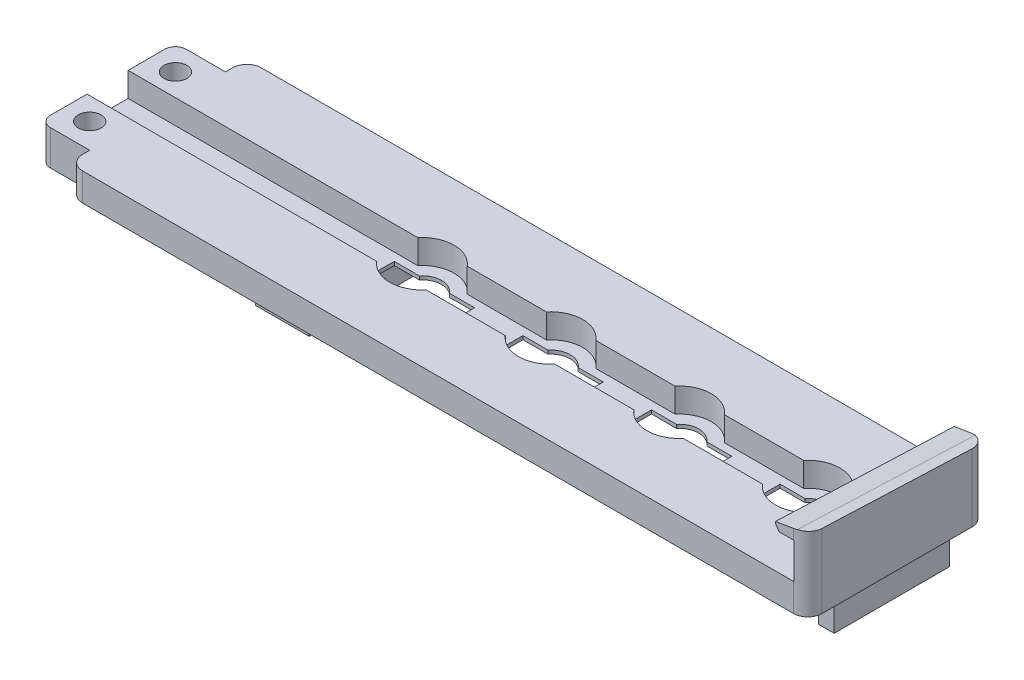
from build123d import *
from OCP.BRepFilletAPI import BRepFilletAPI_MakeChamfer

# Parameters (mm, degrees)
SKETCH1_W                = 99.5
SKETCH1_H                = 25
BOSS_EXTRUDE1_DEPTH      = 3.9
SKETCH2_R                = 2.75
CUT_EXTRUDE1_DEPTH       = 52.444363151
SKETCH4_W                = 2
SKETCH4_H                = 25
BOSS_EXTRUDE2_DEPTH      = 3.9
SNAP_START               = -51.12804878
SNAP_HOOK1_DEPTH         = 1.37804878
SNAP_START_2             = -10.052407779
SNAP_HOOK1_2_DEPTH       = 20.104815558
SNAP_START_3             = -10.267279674
SNAP_HOOK1_3_DEPTH       = 20.534559348
SNAP_START_4             = -53
SNAP_HOOK1_4_DEPTH       = 5
CUT_EXTRUDE2_DEPTH       = 3.4
SKETCH6_W                = 131.446270808
SKETCH6_H                = 5.75
CUT_EXTRUDE3_DEPTH       = 3.4
FILLET3_R                = 2
SKETCH12_W               = 3.5
SKETCH12_H               = 3.5
CUT_EXTRUDE8_DEPTH       = 3.9
SKETCH13_W               = 19.63116991
SKETCH13_H               = 5.75
CUT_EXTRUDE9_DEPTH       = 10
BOSS_EXTRUDE8_DEPTH      = 1
BOSS_EXTRUDE8_DEPTH_BACK = 3.9
SKETCH15_W               = 7
SKETCH15_H               = 19
SKETCH15_R               = 1.6
CUT_EXTRUDE10_DEPTH      = 2
SKETCH17_W               = 7.226910769
SKETCH17_H               = 5.75
CUT_EXTRUDE11_DEPTH      = 3.4
FILLET6_R                = 1.5
SKETCH18_W               = 7.5
SKETCH18_H               = 18
BOSS_EXTRUDE9_DEPTH      = 3.8
SKETCH21_W               = 7.5
SKETCH21_H               = 16.5
SKETCH21_W_2             = 2.196133812
SKETCH21_H_2             = 16.144777587
BOSS_EXTRUDE11_DEPTH     = 3.8
FILLET7_R                = 1
SKETCH22_W               = 5.52852217
SKETCH22_H               = 24.476704992
SKETCH22_W_2             = 17.032273736
SKETCH22_H_2             = 39.798184175
CUT_EXTRUDE14_DEPTH      = 5.1
BOSS_EXTRUDE12_START     = 9.9
BOSS_EXTRUDE12_DEPTH     = 9.9
CUT_EXTRUDE15_DEPTH      = 2.6
CUT_EXTRUDE16_DEPTH      = 105.769556647
CHAMFER1_SIZE            = 3
CHAMFER1_SIZE2           = 0.475153321
CHAMFER2_SIZE            = 0.5
CHAMFER2_SIZE2           = 0.714074003
SKETCH28_W               = 5.417071425
SKETCH28_H               = 25.110658167
CUT_EXTRUDE18_DEPTH      = 61.55660575
SPLIT1_SURFACE_1_BACK    = 115.179
SPLIT1_SURFACE_1_DEPTH   = 230.358
SPLIT1_SURFACE_2_BACK    = 115.179
SPLIT1_SURFACE_2_DEPTH   = 230.358


with BuildPart() as part:
    # Sketch1 → Boss-Extrude1 (new body)
    with BuildSketch(Plane(origin=(0, 0, 0), x_dir=(1, 0, 0), z_dir=(0, 1, 0))):
        Rectangle(SKETCH1_W, SKETCH1_H)
    extrude(amount=BOSS_EXTRUDE1_DEPTH)

    # Sketch2 → Cut-Extrude1 (cut, through all)
    with BuildSketch(Plane(origin=(0, 3.9, 0), x_dir=(1, 0, 0), z_dir=(0, 1, 0))):
        with Locations(Location((-14.75, 0, 0), (0, 0, 270))):
            Circle(SKETCH2_R)
        with Locations(Location((3.25, 0, 0), (0, 0, 270))):
            Circle(SKETCH2_R)
        with Locations(Location((21.25, 0, 0), (0, 0, 270))):
            Circle(SKETCH2_R)
        with Locations(Location((39.25, 0, 0), (0, 0, 270))):
            Circle(SKETCH2_R)
    extrude(amount=-CUT_EXTRUDE1_DEPTH, mode=Mode.SUBTRACT)

    # Sketch4 → Boss-Extrude2 (add)
    with BuildSketch(Plane(origin=(0, 0, 0), x_dir=(1, 0, 0), z_dir=(0, 1, 0))):
        with Locations((-50.75, 0)):
            Rectangle(SKETCH4_W, SKETCH4_H)
        with Locations((50.75, 0)):
            Rectangle(SKETCH4_W, SKETCH4_H)
    extrude(amount=BOSS_EXTRUDE2_DEPTH)

    # Snap Hook1: read off the stored shape, not the designer's step
    # Snap Hook1 outline → Snap Hook1 (add)
    with BuildSketch(Plane.YZ.offset(SNAP_START)):
        Polygon((9, -10), (9, 10), (3.9, 10.267279674), (3.9, -10.267279674), align=None)
    snap_hook1 = extrude(amount=SNAP_HOOK1_DEPTH)

    # Snap Hook1 2 outline → Snap Hook1 2 (add)
    with BuildSketch(Plane.XY.offset(SNAP_START_2)):
        Polygon((-51.12804878, 3.9), (-51.12804878, 9), (-51.75, 3.9), align=None)
        Polygon((-49.75, 9), (-49.75, 8), (-48.75, 8), (-48.75, 8.5), align=None)
    snap_hook1_2 = extrude(amount=SNAP_HOOK1_2_DEPTH)

    # Snap Hook1 3 outline → Snap Hook1 3 (add)
    with BuildSketch(Plane.XY.offset(SNAP_START_3)):
        Polygon((-51.12804878, 3.9), (-51.12804878, 9), (-51.75, 3.9), align=None)
    snap_hook1_3 = extrude(amount=SNAP_HOOK1_3_DEPTH)

    # Snap Hook1 4 outline → Snap Hook1 4 (cut)
    with BuildSketch(Plane.YZ.offset(SNAP_START_4)):
        Polygon((9, 10), (10, 9.947592221), (10, 10.267279674), (3.9, 10.267279674), align=None)
        Polygon((10, -9.947592221), (9, -10), (3.9, -10.267279674), (10, -10.267279674), align=None)
    snap_hook1_4 = extrude(amount=SNAP_HOOK1_4_DEPTH, mode=Mode.SUBTRACT)

    # Mirror1: Snap Hook1, Snap Hook1 2, Snap Hook1 3, Snap Hook1 4 across plane
    add(snap_hook1.mirror(Plane(origin=(0, 0, 0), x_dir=(0, 0, 1), z_dir=(1, 0, 0))))
    add(snap_hook1_2.mirror(Plane(origin=(0, 0, 0), x_dir=(0, 0, 1), z_dir=(1, 0, 0))))
    add(snap_hook1_3.mirror(Plane(origin=(0, 0, 0), x_dir=(0, 0, 1), z_dir=(1, 0, 0))))
    add(snap_hook1_4.mirror(Plane(origin=(0, 0, 0), x_dir=(0, 0, 1), z_dir=(1, 0, 0))), mode=Mode.SUBTRACT)

    # Sketch5 → Cut-Extrude2 (cut)
    with BuildSketch(Plane(origin=(0, 3.9, 0), x_dir=(1, 0, 0), z_dir=(0, 1, 0))):
        with BuildLine():
            Line((-18.75, 2.061552813), (-18.75, -2.061552813))
            ThreePointArc((-18.75, -2.061552813), (-14.75, -4.5), (-10.75, -2.061552813))
            Line((-10.75, -2.061552813), (-10.75, 2.061552813))
            ThreePointArc((-10.75, 2.061552813), (-14.75, 4.5), (-18.75, 2.061552813))
        make_face()
        with BuildLine():
            Line((-0.75, 2.061552813), (-0.75, -2.061552813))
            ThreePointArc((-0.75, -2.061552813), (3.25, -4.5), (7.25, -2.061552813))
            Line((7.25, -2.061552813), (7.25, 2.061552813))
            ThreePointArc((7.25, 2.061552813), (3.25, 4.5), (-0.75, 2.061552813))
        make_face()
        with BuildLine():
            Line((17.25, 2.061552813), (17.25, -2.061552813))
            ThreePointArc((17.25, -2.061552813), (21.25, -4.5), (25.25, -2.061552813))
            Line((25.25, -2.061552813), (25.25, 2.061552813))
            ThreePointArc((25.25, 2.061552813), (21.25, 4.5), (17.25, 2.061552813))
        make_face()
        with BuildLine():
            Line((35.25, 2.061552813), (35.25, -2.061552813))
            ThreePointArc((35.25, -2.061552813), (39.25, -4.5), (43.25, -2.061552813))
            Line((43.25, -2.061552813), (43.25, 2.061552813))
            ThreePointArc((43.25, 2.061552813), (39.25, 4.5), (35.25, 2.061552813))
        make_face()
    extrude(amount=-CUT_EXTRUDE2_DEPTH, mode=Mode.SUBTRACT)

    # Sketch6 → Cut-Extrude3 (cut)
    with BuildSketch(Plane(origin=(0, 3.9, 0), x_dir=(1, 0, 0), z_dir=(0, 1, 0))):
        with Locations((3.25, 0)):
            Rectangle(SKETCH6_W, SKETCH6_H)
    extrude(amount=-CUT_EXTRUDE3_DEPTH, mode=Mode.SUBTRACT)

    # Fillet3
    fillet3_edges = [part.edges().sort_by_distance(p)[0] for p in [
        (-51.75, 1.95, -12.5),
        (-51.75, 1.95, 12.5),
        (51.75, 1.95, 12.5),
        (51.75, 1.95, -12.5),
    ]]
    fillet(fillet3_edges, radius=FILLET3_R)

    # Sketch12 → Cut-Extrude8 (cut)
    with BuildSketch(Plane(origin=(0, 0, 0), x_dir=(1, 0, 0), z_dir=(0, 1, 0))):
        with Locations((-10.878679656, 0)):
            Rectangle(SKETCH12_W, SKETCH12_H)
        with Locations((-18.621320344, 0)):
            Rectangle(SKETCH12_W, SKETCH12_H)
        with Locations((7.121320344, 0)):
            Rectangle(SKETCH12_W, SKETCH12_H)
        with Locations((-0.621320344, 0)):
            Rectangle(SKETCH12_W, SKETCH12_H)
        with Locations((25.121320344, 0)):
            Rectangle(SKETCH12_W, SKETCH12_H)
        with Locations((17.378679656, 0)):
            Rectangle(SKETCH12_W, SKETCH12_H)
        with Locations((43.121320344, 0)):
            Rectangle(SKETCH12_W, SKETCH12_H)
        with Locations((35.378679656, 0)):
            Rectangle(SKETCH12_W, SKETCH12_H)
    extrude(amount=CUT_EXTRUDE8_DEPTH, mode=Mode.SUBTRACT)

    # Sketch13 → Cut-Extrude9 (cut)
    with BuildSketch(Plane(origin=(0, 0.5, 0), x_dir=(1, 0, 0), z_dir=(0, 1, 0))):
        with Locations((-45.74538215, -0.005)):
            Rectangle(SKETCH13_W, SKETCH13_H)
    extrude(amount=CUT_EXTRUDE9_DEPTH, mode=Mode.SUBTRACT)

    # Sketch18 → Boss-Extrude9 (add)
    with BuildSketch(Plane(origin=(0, 0, 0), x_dir=(-1, 0, 0), z_dir=(0, -1, 0))):
        with Locations((25.281035949, 0)):
            Rectangle(SKETCH18_W, SKETCH18_H)
    extrude(amount=BOSS_EXTRUDE9_DEPTH)

    # Sketch21 → Boss-Extrude11 (add)
    with BuildSketch(Plane.XZ):
        with Locations((-25.281035949, 0)):
            Rectangle(SKETCH21_W, SKETCH21_H)
        with Locations((50.098066906, 0.177611206)):
            Rectangle(SKETCH21_W_2, SKETCH21_H_2)
    extrude(amount=BOSS_EXTRUDE11_DEPTH)

    # Sketch22 → Cut-Extrude14 (cut)
    with BuildSketch(Plane(origin=(0, 3.9, 0), x_dir=(1, 0, 0), z_dir=(0, 1, 0))):
        with Locations((-50.419989223, -0.434704532)):
            Rectangle(SKETCH22_W, SKETCH22_H)
        with Locations((49.214622504, 0.682711118)):
            Rectangle(SKETCH22_W_2, SKETCH22_H_2)
    extrude(amount=CUT_EXTRUDE14_DEPTH, mode=Mode.SUBTRACT)



with BuildPart() as body_2:
    # Sketch15 → Boss-Extrude8 (new, two sides: drawn at the far end of the back side and taken through both)
    with BuildSketch(Plane.XZ.offset(-BOSS_EXTRUDE8_DEPTH_BACK)):
        with Locations((-55.25, 0)):
            Rectangle(SKETCH15_W, SKETCH15_H)
        with Locations(Location((-55.25, -6, 0), (0, 0, 90))):
            Circle(SKETCH15_R, mode=Mode.SUBTRACT)
        with Locations(Location((-55.25, 6, 0), (0, 0, 90))):
            Circle(SKETCH15_R, mode=Mode.SUBTRACT)
    extrude(amount=BOSS_EXTRUDE8_DEPTH + BOSS_EXTRUDE8_DEPTH_BACK)

    # Sketch16 → Cut-Extrude10 (cut)
    with BuildSketch(Plane(origin=(0, -1, 0), x_dir=(-1, 0, 0), z_dir=(0, -1, 0))):
        Polygon((56.83771324, -8.75), (58.425426481, -6), (56.83771324, -3.25), (53.66228676, -3.25), (52.074573519, -6), (53.66228676, -8.75), align=None)
        Polygon((53.66228676, 8.75), (56.83771324, 8.75), (58.425426481, 6), (56.83771324, 3.25), (53.66228676, 3.25), (52.074573519, 6), align=None)
    extrude(amount=-CUT_EXTRUDE10_DEPTH, mode=Mode.SUBTRACT)

    # Sketch17 → Cut-Extrude11 (cut)
    with BuildSketch(Plane(origin=(0, 3.9, 0), x_dir=(1, 0, 0), z_dir=(0, 1, 0))):
        with Locations((-55.363455384, 0)):
            Rectangle(SKETCH17_W, SKETCH17_H)
    extrude(amount=-CUT_EXTRUDE11_DEPTH, mode=Mode.SUBTRACT)

    # Fillet6
    fillet6_edges = [body_2.edges().sort_by_distance(p)[0] for p in [
        (-58.75, 1.45, -9.5),
        (-58.75, 1.45, 9.5),
    ]]
    fillet(fillet6_edges, radius=FILLET6_R)

    # Fillet7
    # the kernel refuses this fillet: 1 mm, written as the material it takes off along each edge
    with BuildSketch(Plane(origin=(-51.75, -1, 12), x_dir=(-1, 0, 0), z_dir=(0, 0, -1))) as fillet7_piece_1:
        with BuildLine():
            CenterArc((FILLET7_R, FILLET7_R), FILLET7_R, 180, 90)
            Line((0, FILLET7_R), (0, 0))
            Line((0, 0), (FILLET7_R, 0))
        make_face()
    extrude(amount=24, mode=Mode.SUBTRACT)


with BuildPart() as part_1:
    add(part.part)

    add(body_2.part)  # Boss-Extrude12 merges body 2
    # Sketch23 → Boss-Extrude12 (add)
    with BuildSketch(Plane(origin=(0, 0.5, 0), x_dir=(1, 0, 0), z_dir=(0, 1, 0)).offset(BOSS_EXTRUDE12_START)):
        with BuildLine():
            Line((-47.25, 12.5), (-49.75, 12.5))
            ThreePointArc((-49.75, 12.5), (-51.164213562, 11.914213562), (-51.75, 10.5))
            Line((-51.75, 10.5), (-51.75, 3.546980625))
            Line((-51.75, 3.546980625), (-47.25, 3.546980625))
            Line((-47.25, 3.546980625), (-47.25, 12.5))
        make_face()
        with BuildLine():
            Line((-51.75, -10.5), (-51.75, -3.546980625))
            Line((-51.75, -3.546980625), (-47.25, -3.546980625))
            Line((-47.25, -3.546980625), (-47.25, -12.5))
            Line((-47.25, -12.5), (-49.75, -12.5))
            ThreePointArc((-49.75, -12.5), (-51.164213562, -11.914213562), (-51.75, -10.5))
        make_face()
        with BuildLine():
            Line((47.25, -12.5), (49.75, -12.5))
            ThreePointArc((49.75, -12.5), (51.164213562, -11.914213562), (51.75, -10.5))
            Line((51.75, -10.5), (51.75, -3.546980625))
            Line((51.75, -3.546980625), (51.75, 3.546980625))
            Line((51.75, 3.546980625), (51.75, 10.5))
            ThreePointArc((51.75, 10.5), (51.164213562, 11.914213562), (49.75, 12.5))
            Line((49.75, 12.5), (47.25, 12.5))
            Line((47.25, 12.5), (47.25, 3.546980625))
            Line((47.25, 3.546980625), (47.25, -3.546980625))
            Line((47.25, -3.546980625), (47.25, -12.5))
        make_face()
    extrude(amount=-BOSS_EXTRUDE12_DEPTH)

    # Sketch24 → Cut-Extrude15 (cut)
    with BuildSketch(Plane(origin=(-47.25, 0, 0), x_dir=(0, 0, -1), z_dir=(1, 0, 0))):
        Polygon((12.5, 3.9), (-12.5, 3.9), (-12.5, 8.9), (12.5, 7.9), align=None)
    cut_extrude15 = extrude(amount=-CUT_EXTRUDE15_DEPTH, mode=Mode.SUBTRACT)

    # Mirror2: Cut-Extrude15 across plane
    add(cut_extrude15.mirror(Plane(origin=(0, 0, 0), x_dir=(0, 0, 1), z_dir=(1, 0, 0))), mode=Mode.SUBTRACT)

    # Sketch25 → Cut-Extrude16 (cut, through all)
    with BuildSketch(Plane.ZY.offset(51.75)):
        Polygon((12.5, 10.4), (-15.116009289, 9.295359628), (-15.116009289, 13.641996299), (12.5, 13.641996299), align=None)
    extrude(amount=-CUT_EXTRUDE16_DEPTH, mode=Mode.SUBTRACT)

    # Chamfer1: one chamfer whose edges measure the first distance from different faces: ONE call of the kernel's chamfer builder (chamfer() names one face for all edges)
    chamfer1_edges_1 = [part_1.edges().sort_by_distance(p)[0] for p in [
        (47.25, 9.9, 0),
    ]]
    chamfer1_side_1 = [part_1.faces().sort_by_distance(p)[0] for p in [
        (49.472054691, 9.9, 0),
    ]]
    chamfer1_edges_2 = [part_1.edges().sort_by_distance(p)[0] for p in [
        (-47.25, 9.579060387, -8.023490313),
    ]]
    chamfer1_side_2 = [part_1.faces().sort_by_distance(p)[0] for p in [
        (-49.460742376, 9.582569565, -7.935760876),
    ]]
    chamfer1_edges_3 = [part_1.edges().sort_by_distance(p)[0] for p in [
        (-47.25, 10.220939613, 8.023490313),
    ]]
    chamfer1_side_3 = [part_1.faces().sort_by_distance(p)[0] for p in [
        (-49.460742376, 10.217430435, 7.935760876),
    ]]
    chamfer1 = BRepFilletAPI_MakeChamfer(part_1.part.solid().wrapped)
    for e in chamfer1_edges_1:
        chamfer1.Add(CHAMFER1_SIZE, CHAMFER1_SIZE2, e.wrapped, chamfer1_side_1[0].wrapped)  # the first distance lies on this face
    for e in chamfer1_edges_2:
        chamfer1.Add(CHAMFER1_SIZE, CHAMFER1_SIZE2, e.wrapped, chamfer1_side_2[0].wrapped)  # the first distance lies on this face
    for e in chamfer1_edges_3:
        chamfer1.Add(CHAMFER1_SIZE, CHAMFER1_SIZE2, e.wrapped, chamfer1_side_3[0].wrapped)  # the first distance lies on this face
    add(Compound.cast(chamfer1.Shape()), mode=Mode.REPLACE)

    # Chamfer2: one chamfer whose edges measure the first distance from different faces: ONE call of the kernel's chamfer builder (chamfer() names one face for all edges)
    chamfer2_edges_1 = [part_1.edges().sort_by_distance(p)[0] for p in [
        (-47.25, 8.079060387, -8.023490313),
    ]]
    chamfer2_side_1 = [part_1.faces().sort_by_distance(p)[0] for p in [
        (-47.25, 8.591293742, -8.023490313),
    ]]
    chamfer2_edges_2 = [part_1.edges().sort_by_distance(p)[0] for p in [
        (-47.25, 8.720939613, 8.023490313),
    ]]
    chamfer2_side_2 = [part_1.faces().sort_by_distance(p)[0] for p in [
        (-47.25, 9.233172967, 8.023490313),
    ]]
    chamfer2_edges_3 = [part_1.edges().sort_by_distance(p)[0] for p in [
        (47.25, 8.4, 0),
    ]]
    chamfer2_side_3 = [part_1.faces().sort_by_distance(p)[0] for p in [
        (48.54999673, 8.4, 0),
    ]]
    chamfer2 = BRepFilletAPI_MakeChamfer(part_1.part.solid().wrapped)
    for e in chamfer2_edges_1:
        chamfer2.Add(CHAMFER2_SIZE, CHAMFER2_SIZE2, e.wrapped, chamfer2_side_1[0].wrapped)  # the first distance lies on this face
    for e in chamfer2_edges_2:
        chamfer2.Add(CHAMFER2_SIZE, CHAMFER2_SIZE2, e.wrapped, chamfer2_side_2[0].wrapped)  # the first distance lies on this face
    for e in chamfer2_edges_3:
        chamfer2.Add(CHAMFER2_SIZE, CHAMFER2_SIZE2, e.wrapped, chamfer2_side_3[0].wrapped)  # the first distance lies on this face
    add(Compound.cast(chamfer2.Shape()), mode=Mode.REPLACE)

    # Sketch28 → Cut-Extrude18 (cut, through all)
    with BuildSketch(Plane(origin=(0, 3.9, 0), x_dir=(1, 0, 0), z_dir=(0, 1, 0))):
        with Locations((-49.875699162, -0.055329084)):
            Rectangle(SKETCH28_W, SKETCH28_H)
    extrude(amount=CUT_EXTRUDE18_DEPTH, mode=Mode.SUBTRACT)


with BuildPart() as body_2_2:
    # Split1: the piece behind the surface
    add(part_1.part)
    # Split1 surface: a surface, the sketch's curves swept straight by 230.358 mm
    with BuildLine(Plane.XY.offset(12.5).offset(-SPLIT1_SURFACE_1_BACK), mode=Mode.PRIVATE) as split1_surface_1_path:
        Line((49.75, 16.919816136), (44.344439399, 16.919816136))
        Line((44.344439399, 16.919816136), (44.344439399, 5.082242234))
        Line((44.344439399, 5.082242234), (49.75, 5.082242234))
        Line((49.75, 5.082242234), (49.75, 0))
        Line((49.75, 0), (55.284430015, 0))
        Line((55.284430015, 0), (55.284430015, 16.919816136))
        Line((55.284430015, 16.919816136), (49.75, 16.919816136))
    split1_surface_1 = Shell.extrude(split1_surface_1_path.wire(), (0 * SPLIT1_SURFACE_1_DEPTH, 0 * SPLIT1_SURFACE_1_DEPTH, 1 * SPLIT1_SURFACE_1_DEPTH))
    split(bisect_by=split1_surface_1, keep=Keep.BOTTOM)


with BuildPart() as part_2:
    add(part_1.part)

    # Split1: split by a surface, the side it looks to stays
    # Split1 surface: a surface, the sketch's curves swept straight by 230.358 mm
    with BuildLine(Plane.XY.offset(12.5).offset(-SPLIT1_SURFACE_2_BACK), mode=Mode.PRIVATE) as split1_surface_2_path:
        Line((49.75, 16.919816136), (44.344439399, 16.919816136))
        Line((44.344439399, 16.919816136), (44.344439399, 5.082242234))
        Line((44.344439399, 5.082242234), (49.75, 5.082242234))
        Line((49.75, 5.082242234), (49.75, 0))
        Line((49.75, 0), (55.284430015, 0))
        Line((55.284430015, 0), (55.284430015, 16.919816136))
        Line((55.284430015, 16.919816136), (49.75, 16.919816136))
    split1_surface_2 = Shell.extrude(split1_surface_2_path.wire(), (0 * SPLIT1_SURFACE_2_DEPTH, 0 * SPLIT1_SURFACE_2_DEPTH, 1 * SPLIT1_SURFACE_2_DEPTH))
    split(bisect_by=split1_surface_2, keep=Keep.TOP)


solid = Compound([body_2_2.part, part_2.part])
